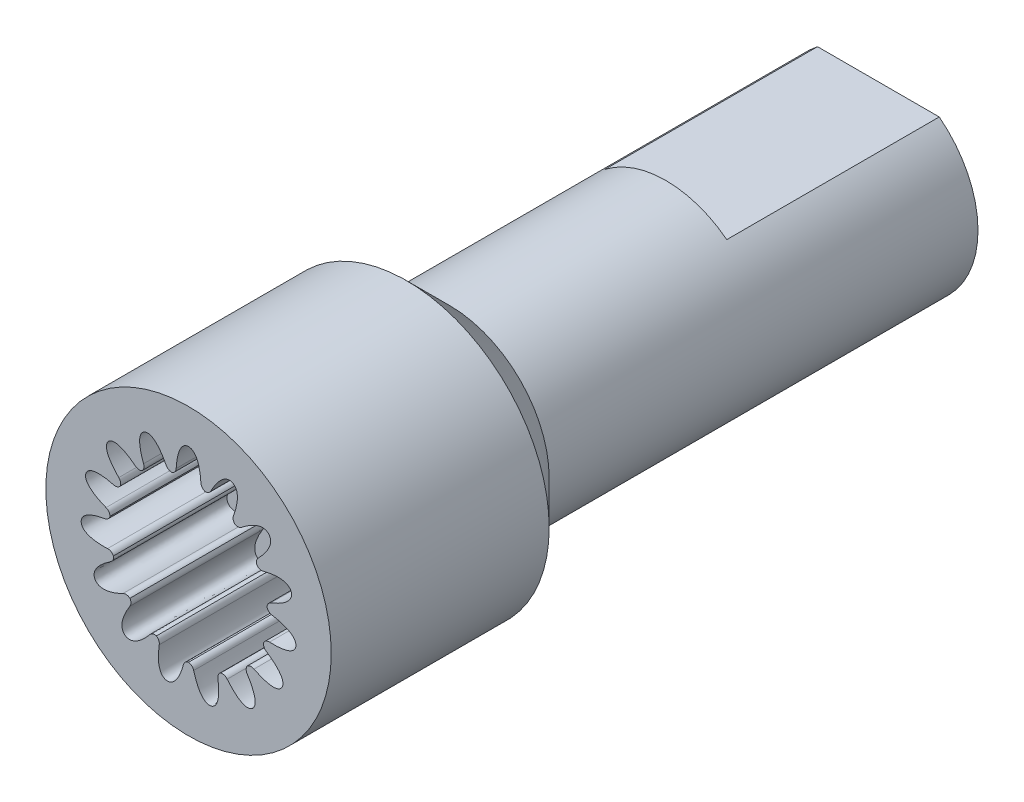
from build123d import *

# Parameters (mm, degrees)
BOSS_EXTRUDE1_DEPTH = 13
SKETCH2_R           = 6.096
BOSS_EXTRUDE2_DEPTH = 12.7
SKETCH3_R           = 8.73125
BOSS_EXTRUDE3_DEPTH = 16.51
SKETCH5_R           = 4.826
CUT_EXTRUDE1_DEPTH  = 8.128
CUT_EXTRUDE2_START  = -8.128
CUT_EXTRUDE2_DEPTH  = 9.128
CIRPATTERN1_COUNT   = 15
FILLET1_START       = 34.082
FILLET1_DEPTH       = 8.918
CHAMFER1_SIZE       = 3.175


with BuildPart() as part:
    # Sketch1 → Boss-Extrude1 (new body)
    with BuildSketch(Plane.XY):
        with BuildLine():
            Line((-3.724371088, 4.826), (3.724371088, 4.826))
            ThreePointArc((3.724371088, 4.826), (0, -6.096), (-3.724371088, 4.826))
        make_face()
    extrude(amount=BOSS_EXTRUDE1_DEPTH)

    # Sketch2 → Boss-Extrude2 (add)
    with BuildSketch(Plane.XY.offset(13)):
        with Locations(Location((0, 0, 0), (0, 0, 127.658462006))):
            Circle(SKETCH2_R)
    extrude(amount=BOSS_EXTRUDE2_DEPTH)

    # Sketch3 → Boss-Extrude3 (add)
    with BuildSketch(Plane.XY.offset(25.7)):
        Circle(SKETCH3_R)
    extrude(amount=BOSS_EXTRUDE3_DEPTH)

    # Sketch5 → Cut-Extrude1 (cut)
    with BuildSketch(Plane.XY.offset(42.21)):
        Circle(SKETCH5_R)
    extrude(amount=-CUT_EXTRUDE1_DEPTH, mode=Mode.SUBTRACT)

    # Cut-Extrude2: read off the stored shape, not the designer's step
    # Cut-Extrude2 outline → Cut-Extrude2 (cut)
    with BuildSketch(Plane.XY.offset(42.21).offset(CUT_EXTRUDE2_START)):
        with BuildLine():
            ThreePointArc((-0.761620627, 4.765523058), (0, 4.826), (0.761620627, 4.765523058))
            add(Edge.make_bspline(
                [(0.761620627, 4.765523058), (0.761873444, 4.785674049), (0.763321433, 5.016368191), (0.734404587, 5.457593501), (0.612246708, 6.007326329), (0.450093948, 6.348568311), (0.244238657, 6.550819656), (0.081412886, 6.604), (0, 6.604), (-0.081412886, 6.604), (-0.244238657, 6.550819656), (-0.450093948, 6.348568311), (-0.612246708, 6.007326329), (-0.734404587, 5.457593501), (-0.763321433, 5.016368191), (-0.761873444, 4.785674049), (-0.761620627, 4.765523058)],
                knots=[4.674779433, 4.674779433, 4.674779433, 4.674779433, 4.71238898, 5.105088062, 5.497787144, 5.890486225, 6.086835766, 6.283185307, 6.283185307, 6.283185307, 6.479534848, 6.675884389, 7.068583471, 7.461282552, 7.853981634, 7.891591182, 7.891591182, 7.891591182, 7.891591182], degree=3))
        make_face()
    cut_extrude2 = extrude(amount=CUT_EXTRUDE2_DEPTH, mode=Mode.SUBTRACT)

    # CirPattern1: Cut-Extrude2 ×15 about axis
    cirpattern1_axis = Axis((0, 0, 37.653), (0, 0, -1))
    for i in range(1, CIRPATTERN1_COUNT):
        add(cut_extrude2.rotate(cirpattern1_axis, i * 360 / CIRPATTERN1_COUNT), mode=Mode.SUBTRACT)

    # Fillet1: read off the stored shape, not the designer's step
    # Fillet1 outline → Fillet1 (cut)
    with BuildSketch(Plane.XY.offset(FILLET1_START)):
        with BuildLine():
            ThreePointArc((2.838857239, 3.907351778), (2.732888041, 4.099003996), (2.749938147, 4.317337085))
            add(Edge.make_bspline(
                [(2.634087916, 4.043742926), (2.642515021, 4.062048942), (2.683459183, 4.152479191), (2.721601125, 4.244157069), (2.749938147, 4.317337085)],
                knots=[4.674779433, 4.674779433, 4.674779433, 4.674779433, 4.71238898, 4.859937402, 4.859937402, 4.859937402, 4.859937402], degree=3))
            ThreePointArc((2.634087916, 4.043742926), (2.836651628, 3.904316015), (3.031850129, 3.754751762))
            add(Edge.make_bspline(
                [(3.256253946, 3.949477124), (3.195412237, 3.899913146), (3.120007902, 3.835307981), (3.046656066, 3.768423286), (3.031850129, 3.754751762)],
                knots=[7.706433212, 7.706433212, 7.706433212, 7.706433212, 7.853981634, 7.891591182, 7.891591182, 7.891591182, 7.891591182], degree=3))
            ThreePointArc((3.256253946, 3.949477124), (3.053875613, 3.865792874), (2.838857239, 3.907351778))
        make_face()
        with BuildLine():
            add(Edge.make_bspline(
                [(1.368338934, 4.932464686), (1.332916753, 4.862439186), (1.290308754, 4.772749725), (1.250502974, 4.681812636), (1.242537787, 4.663300961)],
                knots=[7.706433212, 7.706433212, 7.706433212, 7.706433212, 7.853981634, 7.891591182, 7.891591182, 7.891591182, 7.891591182], degree=3))
            ThreePointArc((1.368338934, 4.932464686), (1.217494578, 4.773700636), (1.00416199, 4.724210732))
            ThreePointArc((1.00416199, 4.724210732), (0.82940233, 4.856192189), (0.756174311, 5.062584294))
            add(Edge.make_bspline(
                [(0.761620627, 4.765523058), (0.761873444, 4.785674049), (0.762496501, 4.884939683), (0.760052147, 4.984205318), (0.756174311, 5.062584294)],
                knots=[4.674779433, 4.674779433, 4.674779433, 4.674779433, 4.71238898, 4.859937402, 4.859937402, 4.859937402, 4.859937402], degree=3))
            ThreePointArc((0.761620627, 4.765523058), (1.00338182, 4.720540321), (1.242537787, 4.663300961))
        make_face()
        with BuildLine():
            ThreePointArc((4.182688281, 2.414876205), (4.163832581, 2.633060774), (4.268212696, 2.825583072))
            add(Edge.make_bspline(
                [(4.051097474, 2.622762905), (4.066241745, 2.636058671), (4.140427394, 2.702017323), (4.212560544, 2.770255506), (4.268212696, 2.825583072)],
                knots=[4.674779433, 4.674779433, 4.674779433, 4.674779433, 4.71238898, 4.859937402, 4.859937402, 4.859937402, 4.859937402], degree=3))
            ThreePointArc((4.051097474, 2.622762905), (4.179438599, 2.413), (4.296928041, 2.196971873))
            add(Edge.make_bspline(
                [(4.581133069, 2.283589088), (4.505391916, 2.263056693), (4.410229341, 2.234706644), (4.316014647, 2.203439314), (4.296928041, 2.196971873)],
                knots=[7.706433212, 7.706433212, 7.706433212, 7.706433212, 7.853981634, 7.891591182, 7.891591182, 7.891591182, 7.891591182], degree=3))
            ThreePointArc((4.581133069, 2.283589088), (4.362213811, 2.289454406), (4.182688281, 2.414876205))
        make_face()
        with BuildLine():
            add(Edge.make_bspline(
                [(-0.75617431, 5.062584294), (-0.760052147, 4.984205318), (-0.762496501, 4.884939683), (-0.761873444, 4.785674049), (-0.761620627, 4.765523058)],
                knots=[7.706433212, 7.706433212, 7.706433212, 7.706433212, 7.853981634, 7.891591182, 7.891591182, 7.891591182, 7.891591182], degree=3))
            ThreePointArc((-0.75617431, 5.062584294), (-0.82940233, 4.856192189), (-1.00416199, 4.724210732))
            ThreePointArc((-1.00416199, 4.724210732), (-1.217494578, 4.773700636), (-1.368338934, 4.932464686))
            add(Edge.make_bspline(
                [(-1.242537787, 4.663300961), (-1.250502974, 4.681812636), (-1.290308754, 4.772749725), (-1.332916753, 4.862439186), (-1.368338934, 4.932464686)],
                knots=[4.674779433, 4.674779433, 4.674779433, 4.674779433, 4.71238898, 4.859937402, 4.859937402, 4.859937402, 4.859937402], degree=3))
            ThreePointArc((-1.242537787, 4.663300961), (-1.00338182, 4.720540321), (-0.761620627, 4.765523058))
        make_face()
        with BuildLine():
            ThreePointArc((4.803294521, 0.504846597), (4.874812641, 0.711837423), (5.048474494, 0.845260077))
            add(Edge.make_bspline(
                [(4.767635475, 0.748283351), (4.786878331, 0.754269907), (4.881478094, 0.784352113), (4.975129976, 0.8173516), (5.048474494, 0.845260077)],
                knots=[4.674779433, 4.674779433, 4.674779433, 4.674779433, 4.71238898, 4.859937402, 4.859937402, 4.859937402, 4.859937402], degree=3))
            ThreePointArc((4.767635475, 0.748283351), (4.799562667, 0.504454364), (4.819028058, 0.259315588))
            add(Edge.make_bspline(
                [(5.113892666, 0.222847752), (5.036348402, 0.234897179), (4.93788206, 0.247704227), (4.839095086, 0.257460667), (4.819028058, 0.259315588)],
                knots=[7.706433212, 7.706433212, 7.706433212, 7.706433212, 7.853981634, 7.891591182, 7.891591182, 7.891591182, 7.891591182], degree=3))
            ThreePointArc((5.113892666, 0.222847752), (4.916285612, 0.31724847), (4.803294521, 0.504846597))
        make_face()
        with BuildLine():
            add(Edge.make_bspline(
                [(-2.749938147, 4.317337085), (-2.721601125, 4.244157069), (-2.683459183, 4.152479191), (-2.642515021, 4.062048942), (-2.634087916, 4.043742926)],
                knots=[7.706433212, 7.706433212, 7.706433212, 7.706433212, 7.853981634, 7.891591182, 7.891591182, 7.891591182, 7.891591182], degree=3))
            ThreePointArc((-2.749938147, 4.317337085), (-2.732888041, 4.099003996), (-2.838857239, 3.907351778))
            ThreePointArc((-2.838857239, 3.907351778), (-3.053875613, 3.865792874), (-3.256253946, 3.949477124))
            add(Edge.make_bspline(
                [(-3.031850129, 3.754751762), (-3.046656066, 3.768423286), (-3.120007902, 3.835307981), (-3.195412237, 3.899913146), (-3.256253946, 3.949477124)],
                knots=[4.674779433, 4.674779433, 4.674779433, 4.674779433, 4.71238898, 4.859937402, 4.859937402, 4.859937402, 4.859937402], degree=3))
            ThreePointArc((-3.031850129, 3.754751762), (-2.836651628, 3.904316015), (-2.634087916, 4.043742926))
        make_face()
        with BuildLine():
            ThreePointArc((4.593367502, -1.492475573), (4.742893309, -1.332469085), (4.955809188, -1.281216065))
            add(Edge.make_bspline(
                [(4.659805991, -1.255581192), (4.679820165, -1.257938975), (4.778476885, -1.268934703), (4.877454236, -1.276879824), (4.955809188, -1.281216065)],
                knots=[4.674779433, 4.674779433, 4.674779433, 4.674779433, 4.71238898, 4.859937402, 4.859937402, 4.859937402, 4.859937402], degree=3))
            ThreePointArc((4.659805991, -1.255581192), (4.589798748, -1.491316015), (4.507874345, -1.723178718))
            add(Edge.make_bspline(
                [(4.762413762, -1.876425984), (4.696474496, -1.833878191), (4.611730112, -1.782128502), (4.525452022, -1.733035268), (4.507874345, -1.723178718)],
                knots=[7.706433212, 7.706433212, 7.706433212, 7.706433212, 7.853981634, 7.891591182, 7.891591182, 7.891591182, 7.891591182], degree=3))
            ThreePointArc((4.762413762, -1.876425984), (4.620286967, -1.709812606), (4.593367502, -1.492475573))
        make_face()
        with BuildLine():
            add(Edge.make_bspline(
                [(-4.268212696, 2.825583072), (-4.212560544, 2.770255506), (-4.140427394, 2.702017323), (-4.066241745, 2.636058671), (-4.051097474, 2.622762905)],
                knots=[7.706433212, 7.706433212, 7.706433212, 7.706433212, 7.853981634, 7.891591182, 7.891591182, 7.891591182, 7.891591182], degree=3))
            ThreePointArc((-4.268212696, 2.825583072), (-4.163832581, 2.633060774), (-4.182688281, 2.414876205))
            ThreePointArc((-4.182688281, 2.414876205), (-4.362213811, 2.289454406), (-4.581133069, 2.283589088))
            add(Edge.make_bspline(
                [(-4.296928041, 2.196971873), (-4.316014647, 2.203439314), (-4.410229341, 2.234706644), (-4.505391916, 2.263056693), (-4.581133069, 2.283589088)],
                knots=[4.674779433, 4.674779433, 4.674779433, 4.674779433, 4.71238898, 4.859937402, 4.859937402, 4.859937402, 4.859937402], degree=3))
            ThreePointArc((-4.296928041, 2.196971873), (-4.179438599, 2.413), (-4.051097474, 2.622762905))
        make_face()
        with BuildLine():
            ThreePointArc((3.589205512, -3.231735159), (3.790884636, -3.146379583), (4.006239452, -3.186158309))
            add(Edge.make_bspline(
                [(3.746253717, -3.042344341), (3.763578579, -3.052638781), (3.849233611, -3.102811181), (3.936422349, -3.150327126), (4.006239452, -3.186158309)],
                knots=[4.674779433, 4.674779433, 4.674779433, 4.674779433, 4.71238898, 4.859937402, 4.859937402, 4.859937402, 4.859937402], degree=3))
            ThreePointArc((3.746253717, -3.042344341), (3.586416928, -3.229224307), (3.417268204, -3.407719769))
            add(Edge.make_bspline(
                [(3.587470254, -3.651248621), (3.544537483, -3.585559362), (3.488168131, -3.503815022), (3.429317192, -3.423873661), (3.417268204, -3.407719769)],
                knots=[7.706433212, 7.706433212, 7.706433212, 7.706433212, 7.853981634, 7.891591182, 7.891591182, 7.891591182, 7.891591182], degree=3))
            ThreePointArc((3.587470254, -3.651248621), (3.525398732, -3.441231551), (3.589205512, -3.231735159))
        make_face()
        with BuildLine():
            add(Edge.make_bspline(
                [(-5.048474494, 0.845260077), (-4.975129976, 0.8173516), (-4.881478094, 0.784352113), (-4.786878331, 0.754269907), (-4.767635475, 0.748283351)],
                knots=[7.706433212, 7.706433212, 7.706433212, 7.706433212, 7.853981634, 7.891591182, 7.891591182, 7.891591182, 7.891591182], degree=3))
            ThreePointArc((-5.048474494, 0.845260077), (-4.874812641, 0.711837423), (-4.803294521, 0.504846597))
            ThreePointArc((-4.803294521, 0.504846597), (-4.916285612, 0.31724847), (-5.113892666, 0.222847752))
            add(Edge.make_bspline(
                [(-4.819028058, 0.259315588), (-4.839095086, 0.257460667), (-4.93788206, 0.247704227), (-5.036348402, 0.234897179), (-5.113892666, 0.222847752)],
                knots=[4.674779433, 4.674779433, 4.674779433, 4.674779433, 4.71238898, 4.859937402, 4.859937402, 4.859937402, 4.859937402], degree=3))
            ThreePointArc((-4.819028058, 0.259315588), (-4.799562667, 0.504454364), (-4.767635475, 0.748283351))
        make_face()
        with BuildLine():
            ThreePointArc((1.964437282, -4.412198376), (2.183397571, -4.416252467), (2.363954518, -4.540184837))
            add(Edge.make_bspline(
                [(2.184940142, -4.303058514), (2.196580065, -4.319509609), (2.254422877, -4.400183418), (2.314747277, -4.479054248), (2.363954518, -4.540184837)],
                knots=[4.674779433, 4.674779433, 4.674779433, 4.674779433, 4.71238898, 4.859937402, 4.859937402, 4.859937402, 4.859937402], degree=3))
            ThreePointArc((2.184940142, -4.303058514), (1.962911039, -4.408770379), (1.735785346, -4.503035113))
            add(Edge.make_bspline(
                [(1.792220548, -4.794737201), (1.779717739, -4.717264746), (1.761470192, -4.619660094), (1.740222264, -4.522693193), (1.735785346, -4.503035113)],
                knots=[7.706433212, 7.706433212, 7.706433212, 7.706433212, 7.853981634, 7.891591182, 7.891591182, 7.891591182, 7.891591182], degree=3))
            ThreePointArc((1.792220548, -4.794737201), (1.820937029, -4.577630298), (1.964437282, -4.412198376))
        make_face()
        with BuildLine():
            add(Edge.make_bspline(
                [(-4.955809188, -1.281216065), (-4.877454236, -1.276879824), (-4.778476885, -1.268934703), (-4.679820165, -1.257938975), (-4.659805991, -1.255581192)],
                knots=[7.706433212, 7.706433212, 7.706433212, 7.706433212, 7.853981634, 7.891591182, 7.891591182, 7.891591182, 7.891591182], degree=3))
            ThreePointArc((-4.955809188, -1.281216065), (-4.742893309, -1.332469085), (-4.593367502, -1.492475573))
            ThreePointArc((-4.593367502, -1.492475573), (-4.620286967, -1.709812606), (-4.762413762, -1.876425984))
            add(Edge.make_bspline(
                [(-4.507874345, -1.723178718), (-4.525452022, -1.733035268), (-4.611730112, -1.782128502), (-4.696474496, -1.833878191), (-4.762413762, -1.876425984)],
                knots=[4.674779433, 4.674779433, 4.674779433, 4.674779433, 4.71238898, 4.859937402, 4.859937402, 4.859937402, 4.859937402], degree=3))
            ThreePointArc((-4.507874345, -1.723178718), (-4.589798748, -1.491316015), (-4.659805991, -1.255581192))
        make_face()
        with BuildLine():
            ThreePointArc((0, -4.82975241), (0.198381229, -4.92251518), (0.312920373, -5.10917216))
            add(Edge.make_bspline(
                [(0.245830567, -4.819734778), (0.249772902, -4.839497985), (0.269801946, -4.936723968), (0.292831371, -5.0333122), (0.312920373, -5.10917216)],
                knots=[4.674779433, 4.674779433, 4.674779433, 4.674779433, 4.71238898, 4.859937402, 4.859937402, 4.859937402, 4.859937402], degree=3))
            ThreePointArc((0.245830567, -4.819734778), (0, -4.826), (-0.245830567, -4.819734778))
            add(Edge.make_bspline(
                [(-0.312920373, -5.10917216), (-0.292831371, -5.0333122), (-0.269801946, -4.936723968), (-0.249772902, -4.839497985), (-0.245830567, -4.819734778)],
                knots=[7.706433212, 7.706433212, 7.706433212, 7.706433212, 7.853981634, 7.891591182, 7.891591182, 7.891591182, 7.891591182], degree=3))
            ThreePointArc((-0.312920373, -5.10917216), (-0.198381229, -4.92251518), (0, -4.82975241))
        make_face()
        with BuildLine():
            add(Edge.make_bspline(
                [(-4.006239452, -3.186158309), (-3.936422349, -3.150327126), (-3.849233611, -3.102811181), (-3.763578579, -3.052638781), (-3.746253717, -3.042344341)],
                knots=[7.706433212, 7.706433212, 7.706433212, 7.706433212, 7.853981634, 7.891591182, 7.891591182, 7.891591182, 7.891591182], degree=3))
            ThreePointArc((-4.006239452, -3.186158309), (-3.790884636, -3.146379583), (-3.589205512, -3.231735159))
            ThreePointArc((-3.589205512, -3.231735159), (-3.525398732, -3.441231551), (-3.587470254, -3.651248621))
            add(Edge.make_bspline(
                [(-3.417268204, -3.407719769), (-3.429317192, -3.423873661), (-3.488168131, -3.503815022), (-3.544537483, -3.585559362), (-3.587470254, -3.651248621)],
                knots=[4.674779433, 4.674779433, 4.674779433, 4.674779433, 4.71238898, 4.859937402, 4.859937402, 4.859937402, 4.859937402], degree=3))
            ThreePointArc((-3.417268204, -3.407719769), (-3.586416928, -3.229224307), (-3.746253717, -3.042344341))
        make_face()
        with BuildLine():
            ThreePointArc((-1.964437282, -4.412198376), (-1.820937029, -4.577630298), (-1.792220548, -4.794737201))
            add(Edge.make_bspline(
                [(-1.735785346, -4.503035113), (-1.740222264, -4.522693193), (-1.761470192, -4.619660094), (-1.779717739, -4.717264746), (-1.792220548, -4.794737201)],
                knots=[4.674779433, 4.674779433, 4.674779433, 4.674779433, 4.71238898, 4.859937402, 4.859937402, 4.859937402, 4.859937402], degree=3))
            ThreePointArc((-1.735785346, -4.503035113), (-1.962911039, -4.408770379), (-2.184940142, -4.303058514))
            add(Edge.make_bspline(
                [(-2.363954518, -4.540184837), (-2.314747277, -4.479054248), (-2.254422877, -4.400183418), (-2.196580065, -4.319509609), (-2.184940142, -4.303058514)],
                knots=[7.706433212, 7.706433212, 7.706433212, 7.706433212, 7.853981634, 7.891591182, 7.891591182, 7.891591182, 7.891591182], degree=3))
            ThreePointArc((-2.363954518, -4.540184837), (-2.183397571, -4.416252467), (-1.964437282, -4.412198376))
        make_face()
    extrude(amount=FILLET1_DEPTH, mode=Mode.SUBTRACT)

    # Chamfer1
    # the kernel refuses this chamfer: 3.175 mm, written as the material it takes off along each edge
    with BuildSketch(Plane(origin=(0, 0, 25.7), x_dir=(1, 0, 0), z_dir=(0, -1, 0))) as chamfer1_piece_1_section:
        Polygon((8.73125, CHAMFER1_SIZE), (8.73125 - CHAMFER1_SIZE, 0), (8.73125, 0), align=None)
    chamfer1_piece_1 = revolve(axis=Axis((0, 0, 25.7), (0, 0, 1)), mode=Mode.PRIVATE)
    chamfer1_piece_1 = chamfer1_piece_1 - Plane(origin=(0, 0, 25.7), x_dir=(-0.6109532624394272, 0.7916666666688831, 0), z_dir=(0, 0, -1)) * Cylinder(6.096, 35, mode=Mode.PRIVATE)
    add(chamfer1_piece_1, mode=Mode.SUBTRACT)


solid = part.part
